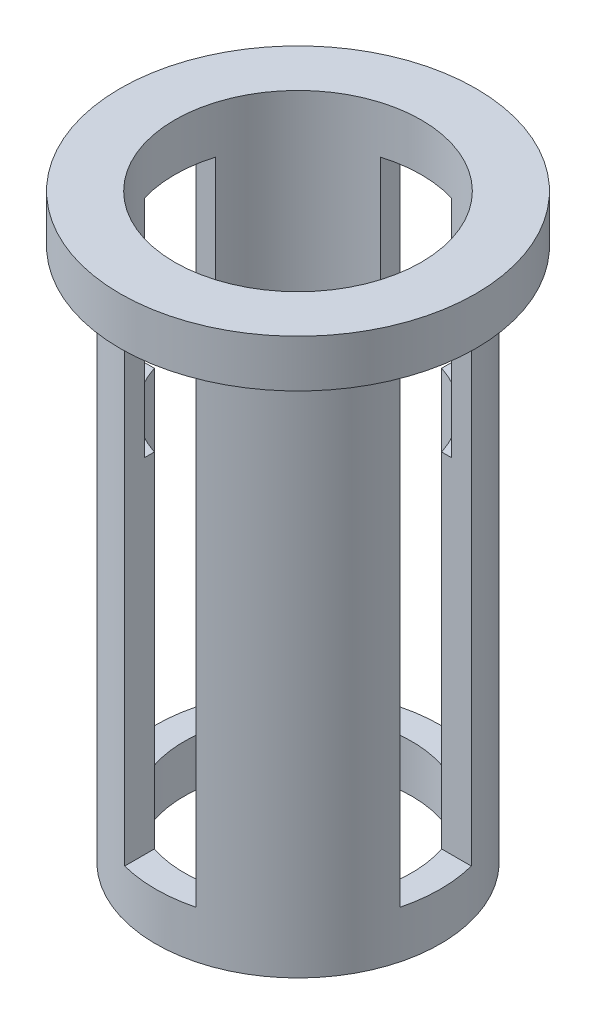
from build123d import *
from build123d.topology import SkipClean

# Parameters (mm, degrees)
SKETCH1_R           = 9.525
SKETCH1_R_2         = 6.604
BOSS_EXTRUDE1_DEPTH = 2.54
BOSS_EXTRUDE2_START = 7.62
SKETCH2_R           = 7.62
SKETCH2_R_2         = 6.604
BOSS_EXTRUDE2_DEPTH = 7.62
BOSS_EXTRUDE3_START = 20.955
SKETCH3_R           = 7.62
SKETCH3_R_2         = 6.096
BOSS_EXTRUDE3_DEPTH = 20.955
SKETCH5_W           = 3.81
SKETCH5_H           = 26.035
CUT_EXTRUDE1_DEPTH  = 37.780699762
SKETCH7_W           = 3.81
SKETCH7_H           = 26.035
CUT_EXTRUDE2_DEPTH  = 37.780699762


with BuildPart() as part:
    # Sketch1 → Boss-Extrude1 (new body)
    with BuildSketch(Plane(origin=(0, 0, 0), x_dir=(1, 0, 0), z_dir=(0, 1, 0))):
        Circle(SKETCH1_R)
        Circle(SKETCH1_R_2, mode=Mode.SUBTRACT)
    extrude(amount=BOSS_EXTRUDE1_DEPTH)

    # Sketch2 → Boss-Extrude2 (add)
    with SkipClean():  # the faces are left unmerged after this step: merging them gives an invalid solid
        with BuildSketch(Plane(origin=(0, 0, 0), x_dir=(-1, 0, 0), z_dir=(0, -1, 0)).offset(BOSS_EXTRUDE2_START)):
            Circle(SKETCH2_R)
            Circle(SKETCH2_R_2, mode=Mode.SUBTRACT)
        extrude(amount=-BOSS_EXTRUDE2_DEPTH)

    # Sketch3 → Boss-Extrude3 (add)
    with SkipClean():  # the faces are left unmerged after this step: merging them gives an invalid solid
        with BuildSketch(Plane(origin=(0, -7.62, 0), x_dir=(-1, 0, 0), z_dir=(0, -1, 0)).offset(BOSS_EXTRUDE3_START)):
            Circle(SKETCH3_R)
            Circle(SKETCH3_R_2, mode=Mode.SUBTRACT)
        extrude(amount=-BOSS_EXTRUDE3_DEPTH)

    # Sketch5 → Cut-Extrude1 (cut, through all)
    with SkipClean():  # the faces are left unmerged after this step: merging them gives an invalid solid
        with BuildSketch(Plane(origin=(0, -28.575, 7.62), x_dir=(1, 0, 0), z_dir=(0, 0, 1))):
            with Locations((0, 15.5575)):
                Rectangle(SKETCH5_W, SKETCH5_H)
        extrude(amount=-CUT_EXTRUDE1_DEPTH, mode=Mode.SUBTRACT)

    # Sketch7 → Cut-Extrude2 (cut, through all)
    with SkipClean():  # the faces are left unmerged after this step: merging them gives an invalid solid
        with BuildSketch(Plane(origin=(7.62, -28.575, 0), x_dir=(0, 0, -1), z_dir=(1, 0, 0))):
            with Locations((0, 15.5575)):
                Rectangle(SKETCH7_W, SKETCH7_H)
        extrude(amount=-CUT_EXTRUDE2_DEPTH, mode=Mode.SUBTRACT)
    add(part.part.scale(1), mode=Mode.REPLACE)  # the faces are merged on a copy


solid = part.part
